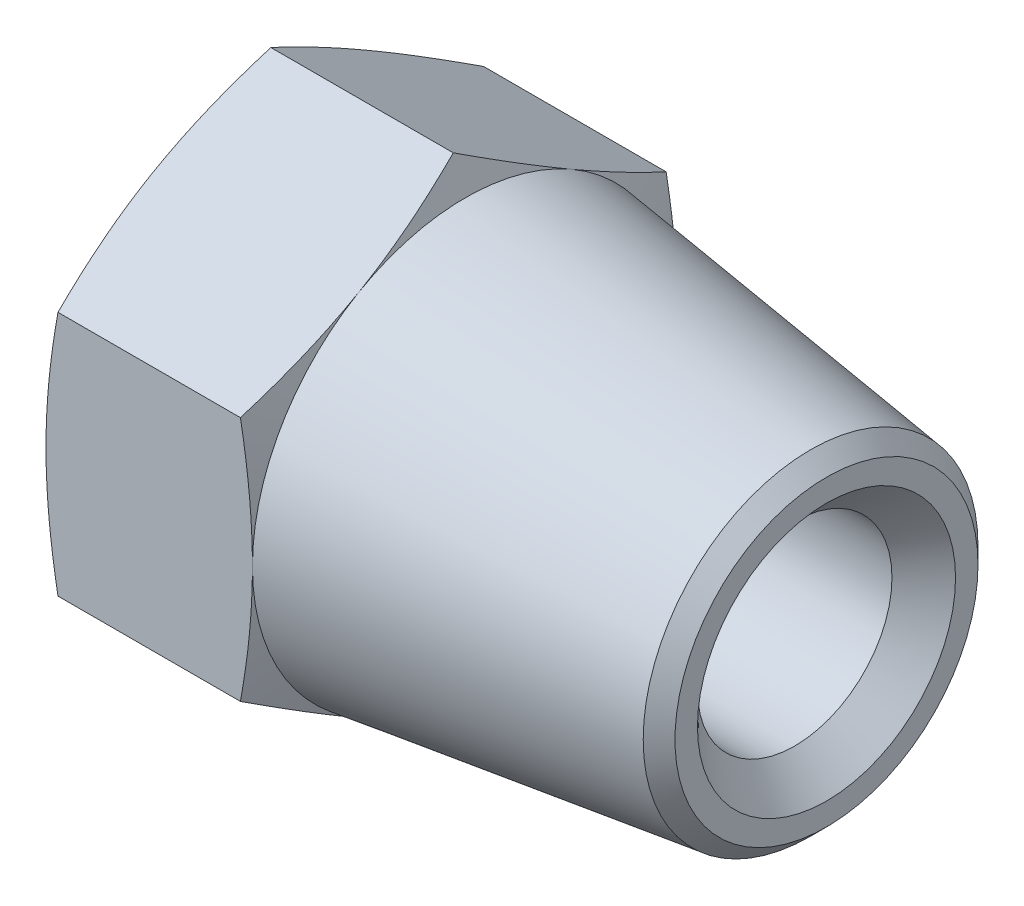
from build123d import *

# Parameters (mm, degrees)
SKETCH1_W          = 6.35
SKETCH1_H          = 5.55625
CUT_SWEEP1_PITCH   = 1.27
EXTRUDE1_DEPTH     = 6.927272727
SKETCH10_OUTSIDE_W = 97.386
SKETCH10_OUTSIDE_H = 99.596
SKETCH10_OUTSIDE_R = 7.14375
CUT_EXTRUDE2_DEPTH = 13.925342945
CUT_EXTRUDE2_DRAFT = -70
SKETCH11_OUTSIDE_W = 97.386
SKETCH11_OUTSIDE_H = 99.596
SKETCH11_OUTSIDE_R = 7.14375
CUT_EXTRUDE3_DEPTH = 13.925342999
CUT_EXTRUDE3_DRAFT = -70


with BuildPart() as part:
    # Sketch1 → Revolve1 (revolve)
    with BuildSketch(Plane.XY, mode=Mode.PRIVATE) as revolve1_sk:
        with Locations((3.175, 2.778125)):
            Rectangle(SKETCH1_W, SKETCH1_H)
    revolve(revolve1_sk.sketch.rotate(Axis((0, 0, 0), (-1, 0, 0)), 90), axis=Axis((0, 0, 0), (-1, 0, 0)))

    # Cut-Sweep1: the profile of Sketch13 profile screwed along a right-hand helix of 6 turns, 8 arcs to a turn; built about Z, then put on its axis
    cut_sweep1_z = Axis((0, 0, 0), (0, 0, 1))
    cut_sweep1_corners = [(5.55655, 0, -1.111423205), (5.55655, 0, 0.000173205), (4.731360803, 0, -0.47625), (4.731360803, 0, -0.635)]
    with BuildLine(mode=Mode.PRIVATE) as cut_sweep1_profile:
        Line(cut_sweep1_corners[0], cut_sweep1_corners[1])
        Line(cut_sweep1_corners[1], cut_sweep1_corners[2])
        Line(cut_sweep1_corners[2], cut_sweep1_corners[3])
        Line(cut_sweep1_corners[3], cut_sweep1_corners[0])
    cut_sweep1_cap = Face(cut_sweep1_profile.wire())
    cut_sweep1_turn_angles = [0, 22.5, 45, 67.5, 90, 112.5, 135, 157.5, 180, 202.5, 225, 247.5, 270, 292.5, 315, 337.5, 360]
    cut_sweep1_turn_weights = [1, 0.9238795325112867, 1, 0.9238795325112867, 1, 0.9238795325112867, 1, 0.9238795325112867, 1, 0.9238795325112867, 1, 0.9238795325112867, 1, 0.9238795325112867, 1, 0.9238795325112867, 1]
    cut_sweep1_turn_rails = [Edge.make_bspline([Vector(p[0], p[1], 0).rotate(cut_sweep1_z, cut_sweep1_turn_angles[k]) / cut_sweep1_turn_weights[k] + Vector(0, 0, p[2] + CUT_SWEEP1_PITCH * cut_sweep1_turn_angles[k] / 360) for k in range(17)], [0, 0, 0, 1, 1, 2, 2, 3, 3, 4, 4, 5, 5, 6, 6, 7, 7, 8, 8, 8], 2, cut_sweep1_turn_weights) for p in cut_sweep1_corners]
    cut_sweep1_turn_sides = [Face.make_surface_from_curves(cut_sweep1_turn_rails[p[0]], cut_sweep1_turn_rails[p[1]]) for p in [(0, 1), (1, 2), (2, 3), (3, 0)]]
    cut_sweep1 = Plane(origin=(0, 0, 0), x_dir=(0, 1, 0), z_dir=(1, 0, 0)) * Solid(Shell([*[p.moved(Location((0, 0, CUT_SWEEP1_PITCH * i))) for i in range(6) for p in cut_sweep1_turn_sides], cut_sweep1_cap, cut_sweep1_cap.rotate(cut_sweep1_z, 2160).moved(Location((0, 0, CUT_SWEEP1_PITCH * 2160 / 360)))]))
    add(cut_sweep1, mode=Mode.SUBTRACT)


with BuildPart() as body_2:
    # Sketch4 → Extrude1 (new body)
    with BuildSketch(Plane.ZY):
        Polygon((0, 8.248891971), (-7.14375, 4.124445986), (-7.14375, -4.124445986), (0, -8.248891971), (7.14375, -4.124445986), (7.14375, 4.124445986), align=None)
    extrude(amount=-EXTRUDE1_DEPTH)

    # Combine1: cut part
    add(part.part, mode=Mode.SUBTRACT)

    # Cut-Extrude1 cone 1 section (through the dimple's axis) → Cut-Extrude1 (revolve, cut)
    with BuildSketch(Plane.ZX):
        Polygon((0, 0), (5.55625, 0), (0, 5.55625), align=None)
    revolve(axis=Axis((0, 0, 0), (1, 0, 0)), mode=Mode.SUBTRACT)


with BuildPart() as cut_extrude2_tool:
    # Sketch10 outside → Cut-Extrude2 (with draft: the straight prism first)
    with BuildSketch(Plane.ZY):
        Rectangle(SKETCH10_OUTSIDE_W, SKETCH10_OUTSIDE_H)
        Circle(SKETCH10_OUTSIDE_R, mode=Mode.SUBTRACT)
    extrude(amount=-CUT_EXTRUDE2_DEPTH)
    # Cut-Extrude2: the draft: its side faces are tilted about the plane it starts from
    cut_extrude2_sides = [cut_extrude2_tool.faces().sort_by_distance(p)[0] for p in [
        (6.962671473, -49.798, 0),
        (6.962671473, 0, 48.693),
        (6.962671473, 49.798, 0),
        (6.962671473, 0, -48.693),
        (6.962671473, 0, -7.14375),
    ]]
    draft(cut_extrude2_sides, Plane.ZY, CUT_EXTRUDE2_DRAFT)


with BuildPart() as body_2_1:
    add(body_2.part)

    # Cut-Extrude2: cut by cut_extrude2_tool
    add(cut_extrude2_tool.part, mode=Mode.SUBTRACT)


with BuildPart() as cut_extrude3_tool:
    # Sketch11 outside → Cut-Extrude3 (with draft: the straight prism first)
    with BuildSketch(Plane(origin=(6.927272727, 0, 0), x_dir=(0, 0, -1), z_dir=(1, 0, 0))):
        Rectangle(SKETCH11_OUTSIDE_W, SKETCH11_OUTSIDE_H)
        Circle(SKETCH11_OUTSIDE_R, mode=Mode.SUBTRACT)
    extrude(amount=-CUT_EXTRUDE3_DEPTH)
    # Cut-Extrude3: the draft: its side faces are tilted about the plane it starts from
    cut_extrude3_sides = [cut_extrude3_tool.faces().sort_by_distance(p)[0] for p in [
        (-0.035398772, -49.798, 0),
        (-0.035398772, 0, -48.693),
        (-0.035398772, 49.798, 0),
        (-0.035398772, 0, 48.693),
        (-0.035398772, 0, 7.14375),
    ]]
    draft(cut_extrude3_sides, Plane(origin=(6.927272727, 0, 0), x_dir=(0, 0, -1), z_dir=(1, 0, 0)), CUT_EXTRUDE3_DRAFT)


with BuildPart() as body_2_2:
    add(body_2_1.part)

    # Cut-Extrude3: cut by cut_extrude3_tool
    add(cut_extrude3_tool.part, mode=Mode.SUBTRACT)

    # Sketch5 → Revolve2 (revolve)
    with BuildSketch(Plane.XY, mode=Mode.PRIVATE) as revolve2_sk:
        Polygon((6.927272727, 7.14375), (6.927272727, 3.2639), (17.983412674, 3.2639), (19.05, 4.330487326), (19.05, 5.084678457), (18.516706337, 5.61797212), align=None)
    revolve(revolve2_sk.sketch.rotate(Axis((19.05, 0, 0), (-1, 0, 0)), 90), axis=Axis((19.05, 0, 0), (-1, 0, 0)))

    # Sketch7 → Cut-Revolve3 (revolve, cut)
    with BuildSketch(Plane.XY, mode=Mode.PRIVATE) as cut_revolve3_sk:
        Polygon((11.90625, 0), (6.35, 5.55625), (6.35, 0), align=None)
    revolve(cut_revolve3_sk.sketch.rotate(Axis((0, 0, 0), (1, 0, 0)), 270), axis=Axis((0, 0, 0), (1, 0, 0)), mode=Mode.SUBTRACT)


solid = body_2_2.part
